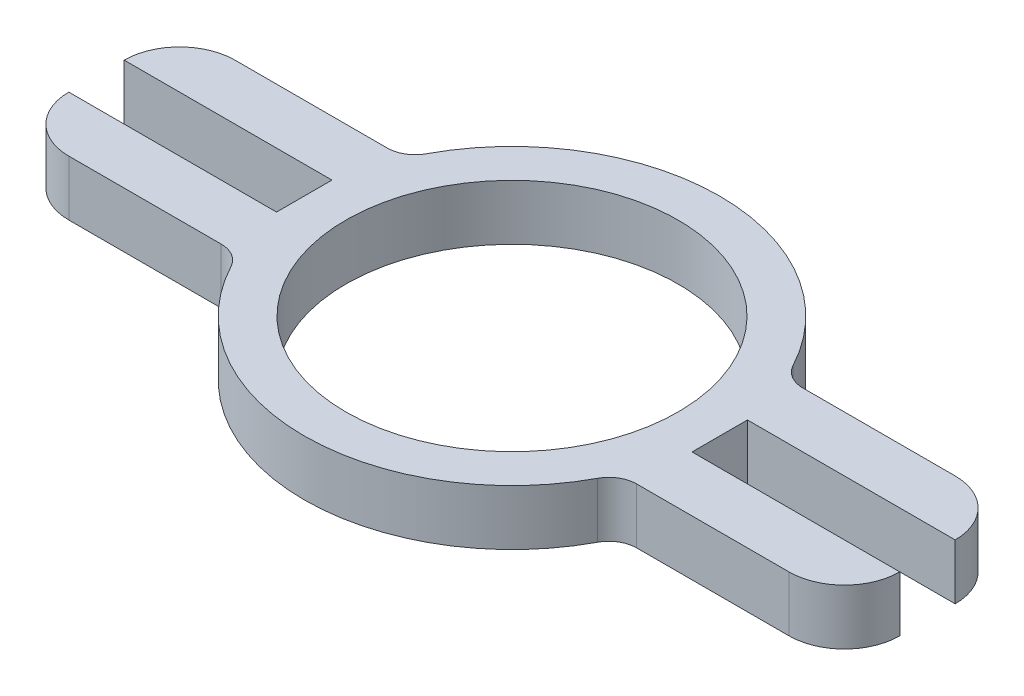
from build123d import *
from build123d.topology import SkipClean

# Parameters (mm, degrees)
BOSS_EXTRUDE1_DEPTH = 20
SKETCH2_W           = 75
SKETCH2_H           = 20
CUT_EXTRUDE1_DEPTH  = 20
FILLET1_R           = 10
FILLET2_R           = 20


with BuildPart() as part:
    # Sketch1 → Boss-Extrude1 (new body)
    with BuildSketch(Plane(origin=(0, 0, 0), x_dir=(1, 0, 0), z_dir=(0, 1, 0))):
        with BuildLine():
            Line((68.738635424, 30), (150, 30))
            Line((150, 30), (150, -30))
            Line((150, -30), (68.738635424, -30))
            ThreePointArc((68.738635424, -30), (41.079191813, -62.74950199), (0, -75))
            Line((0, -75), (0, 75))
            ThreePointArc((0, 75), (41.079191813, 62.74950199), (68.738635424, 30))
        make_face()
    boss_extrude1 = extrude(amount=BOSS_EXTRUDE1_DEPTH)

    # Sketch2 → Cut-Extrude1 (cut)
    with BuildSketch(Plane(origin=(0, 20, 0), x_dir=(1, 0, 0), z_dir=(0, 1, 0))):
        with BuildLine():
            Line((0, 60), (0, -60))
            ThreePointArc((0, -60), (60, 0), (0, 60))
        make_face()
        with Locations((112.5, 0)):
            Rectangle(SKETCH2_W, SKETCH2_H)
    cut_extrude1 = extrude(amount=-CUT_EXTRUDE1_DEPTH, mode=Mode.SUBTRACT)

    # Mirror1: Boss-Extrude1, Cut-Extrude1 across plane
    with SkipClean():  # the faces are left unmerged after this step: merging them gives an invalid solid
        add(boss_extrude1.mirror(Plane(origin=(0, 0, 0), x_dir=(0, 0, 1), z_dir=(1, 0, 0))))
        add(cut_extrude1.mirror(Plane(origin=(0, 0, 0), x_dir=(0, 0, 1), z_dir=(1, 0, 0))), mode=Mode.SUBTRACT)
    add(part.part.scale(1), mode=Mode.REPLACE)  # the faces are merged on a copy

    # Fillet1
    fillet1_edges = [part.edges().sort_by_distance(p)[0] for p in [
        (68.738635424, 10, -30),
        (68.738635424, 10, 30),
        (-68.738635424, 10, -30),
        (-68.738635424, 10, 30),
    ]]
    fillet(fillet1_edges, radius=FILLET1_R)

    # Fillet2
    fillet2_edges = [part.edges().sort_by_distance(p)[0] for p in [
        (-150, 10, 30),
        (-150, 10, -30),
        (150, 10, -30),
        (150, 10, 30),
    ]]
    fillet(fillet2_edges, radius=FILLET2_R - 0.0001)  # a hair under: the kernel refuses the full size


solid = part.part
